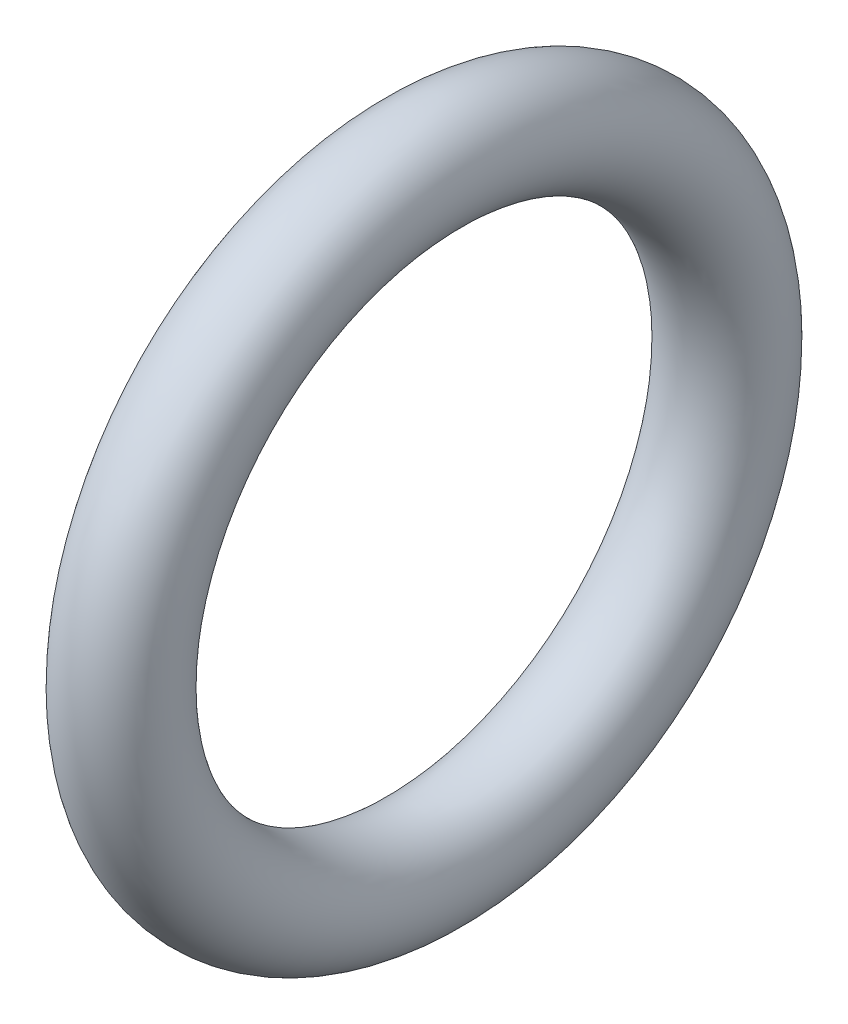
from build123d import *

# Parameters (mm, degrees)
SKETCH4_R = 0.95


with BuildPart() as part:
    # Sketch4 → Revolve1 (revolve)
    with BuildSketch(Plane.XY):
        with Locations((0, 5.425)):
            Circle(SKETCH4_R)
    revolve(axis=Axis((0, 0, 0), (1, 0, 0)))


solid = part.part
